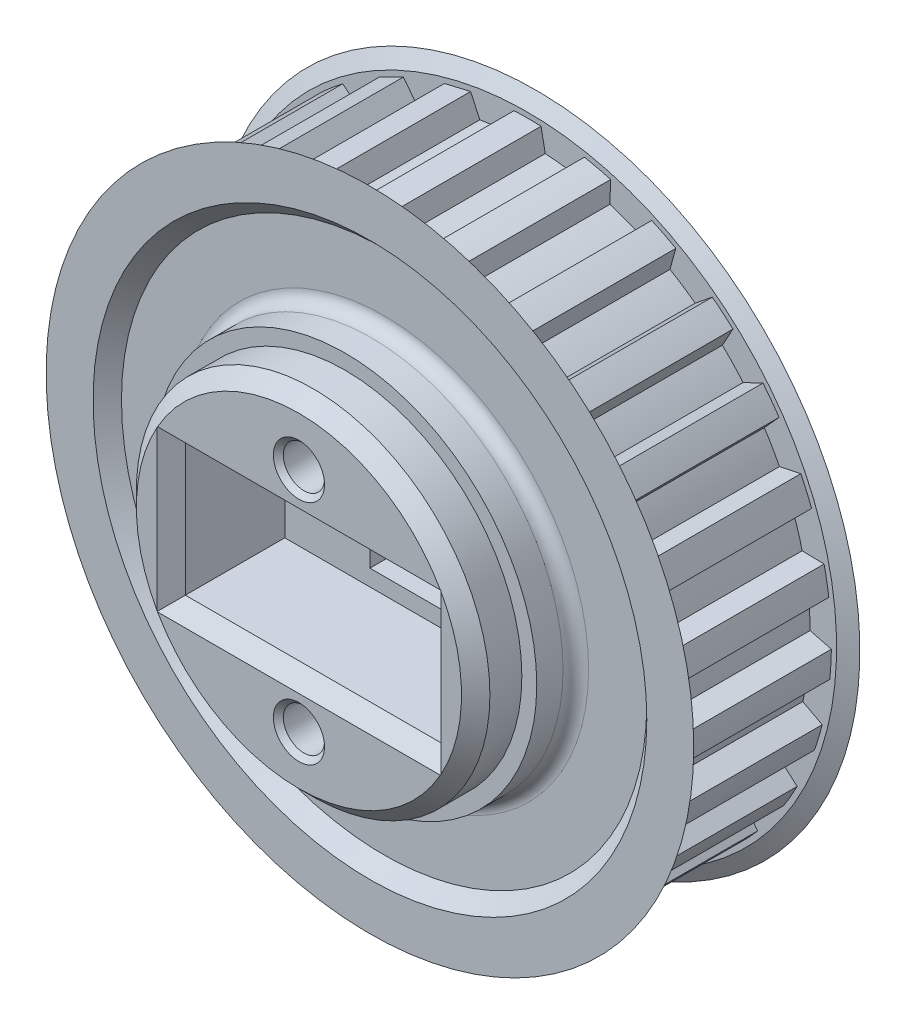
from build123d import *

# Parameters (mm, degrees)
CROQUIS1_R                 = 1.5
SALIENTE_EXTRUIR1_DEPTH    = 10.5
CROQUIS2_R                 = 23.5
CROQUIS2_R_2               = 1.5
SALIENTE_EXTRUIR2_DEPTH    = 0.6
SALIENTE_EXTRUIR4_START    = 5.25
CROQUIS4_R                 = 12.45
CROQUIS4_R_2               = 1.5
SALIENTE_EXTRUIR4_DEPTH    = 5.25
SALIENTE_EXTRUIR6_START    = 0.6
CROQUIS6_R                 = 23.5
CROQUIS6_R_2               = 1.5
SALIENTE_EXTRUIR6_DEPTH    = 0.6
SKETCH6_R                  = 18.5
SKETCH6_R_2                = 12.45
CUT_EXTRUDE3_DEPTH         = 1
SALIENTE_EXTRUIR5_START    = 2.65
CROQUIS5_R                 = 13.5
CROQUIS5_R_2               = 1.5
SALIENTE_EXTRUIR5_DEPTH    = 2.65
CHAFL_N2_SIZE              = 1.732050808
CHAFL_N2_SIZE_2            = 1
CROQUIS3_R                 = 12.45
CROQUIS3_R_2               = 1.5
SALIENTE_EXTRUIR7_DEPTH    = 5
CUT_EXTRUDE4_START         = -1
SKETCH7_R                  = 18.5
SKETCH7_R_2                = 12.45
CUT_EXTRUDE4_DEPTH         = 1
CHAFL_N4_SIZE              = 1
CROQUIS7_R                 = 13.5
CROQUIS7_R_2               = 1.5
SALIENTE_EXTRUIR8_DEPTH    = 2.75
CORTAR_EXTRUIR1_DEPTH      = 37.049200957
CORTAR_EXTRUIR1_DEPTH_BACK = 37.049200957
CROQUIS8_R                 = 1.45
CROQUIS8_W                 = 6
CROQUIS8_H                 = 7
CROQUIS10_W                = 18
CROQUIS10_H                = 9.3
CORTAR_EXTRUIR3_DEPTH      = 8
CHAFL_N5_SIZE              = 1
SKETCH1_R                  = 12.45
SKETCH1_R_2                = 1.45
BOSS_EXTRUDE1_DEPTH        = 5
SKETCH2_R                  = 1.45
CUT_EXTRUDE1_DEPTH         = 39.680193764
SKETCH4_W                  = 6
SKETCH4_H                  = 7
CUT_EXTRUDE2_DEPTH         = 30
CHAMFER3_SIZE              = 1
CHAMFER2_SIZE              = 0.75
CHAMFER4_SIZE              = 1
CHAMFER5_SIZE              = 0.35
FILLET1_R                  = 0.9


# Some blends are built 0.0001 mm under size
with BuildPart() as part:
    # Croquis1 → Saliente-Extruir1 (new body)
    with BuildSketch(Plane.XY):
        with BuildLine():
            Line((-0.95, 21.378903152), (-1.25, 19.860702404))
            ThreePointArc((-1.25, 19.860702404), (-2.310248991, 19.765443319), (-3.36388709, 19.613624439))
            Line((-3.36388709, 19.613624439), (-4.005921739, 21.021717128))
            Line((-4.005921739, 21.021717128), (-5.854706993, 20.583546974))
            Line((-5.854706993, 20.583546974), (-5.796499267, 19.037084762))
            ThreePointArc((-5.796499267, 19.037084762), (-6.806200852, 18.699883154), (-7.796426157, 18.309170904))
            Line((-7.796426157, 18.309170904), (-8.7458832, 19.531244892))
            Line((-8.7458832, 19.531244892), (-10.443785217, 18.67852645))
            Line((-10.443785217, 18.67852645), (-10.030507758, 17.187172953))
            ThreePointArc((-10.030507758, 17.187172953), (-10.935228664, 16.626207447), (-11.808657871, 16.017665226))
            Line((-11.808657871, 16.017665226), (-13.014351834, 16.987838189))
            ThreePointArc((-13.014351834, 16.987838189), (-13.755654847, 16.393351083), (-14.469836276, 15.766541731))
            Line((-14.469836276, 15.766541731), (-13.723768979, 14.410696201))
            ThreePointArc((-13.723768979, 14.410696201), (-14.474735467, 13.656208594), (-15.184281783, 12.862643069))
            Line((-15.184281783, 12.862643069), (-16.581213392, 13.528612732))
            ThreePointArc((-16.581213392, 13.528612732), (-17.165436325, 12.779193862), (-17.715814716, 12.004578666))
            Line((-17.715814716, 12.004578666), (-16.677178263, 10.857335087))
            ThreePointArc((-16.677178263, 10.857335087), (-17.233905535, 9.95), (-17.741317134, 9.014192495))
            Line((-17.741317134, 9.014192495), (-19.254177444, 9.34005626))
            ThreePointArc((-19.254177444, 9.34005626), (-19.649824687, 8.476106993), (-20.006729, 7.595445657))
            Line((-20.006729, 7.595445657), (-18.731516549, 6.718652228))
            ThreePointArc((-18.731516549, 6.718652228), (-19.063991295, 5.707384331), (-19.341913486, 4.679784471))
            Line((-19.341913486, 4.679784471), (-20.889143807, 4.647974938))
            ThreePointArc((-20.889143807, 4.647974938), (-21.074885914, 3.716071002), (-21.219075344, 2.776840208))
            Line((-21.219075344, 2.776840208), (-19.77603393, 2.217765088))
            ThreePointArc((-19.77603393, 2.217765088), (-19.86633235, 1.157082095), (-19.899782276, 0.093088054))
            Line((-19.899782276, 0.093088054), (-21.397971019, -0.294679916))
            ThreePointArc((-21.397971019, -0.294679916), (-21.363794587, -1.244299339), (-21.287495844, -2.191465416))
            Line((-21.287495844, -2.191465416), (-19.754420203, -2.402682341))
            ThreePointArc((-19.754420203, -2.402682341), (-19.597674285, -3.455598736), (-19.384848652, -4.498626763))
            Line((-19.384848652, -4.498626763), (-20.753228076, -5.221448499))
            ThreePointArc((-20.753228076, -5.221448499), (-20.500975564, -6.13758918), (-20.208301934, -7.041628573))
            Line((-20.208301934, -7.041628573), (-18.66784057, -6.893600544))
            ThreePointArc((-18.66784057, -6.893600544), (-18.272500527, -7.881987344), (-17.824872819, -8.847819448))
            Line((-17.824872819, -8.847819448), (-18.989673235, -9.866727443))
            ThreePointArc((-18.989673235, -9.866727443), (-18.532943641, -10.7), (-18.039673235, -11.51217571))
            Line((-18.039673235, -11.51217571), (-16.574872819, -11.012882957))
            ThreePointArc((-16.574872819, -11.012882957), (-15.962251536, -11.883455975), (-15.303953479, -12.720023895))
            Line((-15.303953479, -12.720023895), (-16.202380195, -13.980088556))
            ThreePointArc((-16.202380195, -13.980088556), (-15.56579593, -14.68557105), (-14.898521083, -15.362098475))
            Line((-14.898521083, -15.362098475), (-13.588349385, -14.538457999))
            ThreePointArc((-13.588349385, -14.538457999), (-12.791473433, -15.244284418), (-11.957994046, -15.906488562))
            Line((-11.957994046, -15.906488562), (-12.541612644, -17.339779476))
            ThreePointArc((-12.541612644, -17.339779476), (-11.759492131, -17.879439164), (-10.954185803, -18.383846534))
            Line((-10.954185803, -18.383846534), (-9.869274518, -17.280261008))
            ThreePointArc((-9.869274518, -17.280261008), (-8.931103686, -17.783289542), (-7.967376059, -18.235430314))
            Line((-7.967376059, -18.235430314), (-8.20472351, -19.764678397))
            ThreePointArc((-8.20472351, -19.764678397), (-7.319231067, -20.109422085), (-6.419307531, -20.414516669))
            Line((-6.419307531, -20.414516669), (-5.618144507, -19.090480672))
            ThreePointArc((-5.618144507, -19.090480672), (-4.589255828, -19.363592925), (-3.547234766, -19.581295297))
            Line((-3.547234766, -19.581295297), (-3.425515608, -21.124058389))
            ThreePointArc((-3.425515608, -21.124058389), (-2.484388362, -21.255300856), (-1.538362728, -21.344634926))
            Line((-1.538362728, -21.344634926), (-1.064138872, -19.871527583))
            ThreePointArc((-1.064138872, -19.871527583), (0, -19.9), (1.064138872, -19.871527583))
            Line((1.064138872, -19.871527583), (1.538362728, -21.344634926))
            ThreePointArc((1.538362728, -21.344634926), (2.484388362, -21.255300856), (3.425515608, -21.124058389))
            Line((3.425515608, -21.124058389), (3.547234766, -19.581295297))
            ThreePointArc((3.547234766, -19.581295297), (4.589255828, -19.363592925), (5.618144507, -19.090480672))
            Line((5.618144507, -19.090480672), (6.419307531, -20.414516669))
            ThreePointArc((6.419307531, -20.414516669), (7.319231067, -20.109422085), (8.20472351, -19.764678397))
            Line((8.20472351, -19.764678397), (7.967376059, -18.235430314))
            ThreePointArc((7.967376059, -18.235430314), (8.931103686, -17.783289542), (9.869274518, -17.280261008))
            Line((9.869274518, -17.280261008), (10.954185803, -18.383846534))
            ThreePointArc((10.954185803, -18.383846534), (11.759492131, -17.879439164), (12.541612644, -17.339779476))
            Line((12.541612644, -17.339779476), (11.957994046, -15.906488562))
            ThreePointArc((11.957994046, -15.906488562), (12.791473433, -15.244284418), (13.588349385, -14.538457999))
            Line((13.588349385, -14.538457999), (14.898521083, -15.362098475))
            ThreePointArc((14.898521083, -15.362098475), (15.56579593, -14.68557105), (16.202380195, -13.980088556))
            Line((16.202380195, -13.980088556), (15.303953479, -12.720023895))
            ThreePointArc((15.303953479, -12.720023895), (15.962251536, -11.883455975), (16.574872819, -11.012882957))
            Line((16.574872819, -11.012882957), (18.039673235, -11.51217571))
            ThreePointArc((18.039673235, -11.51217571), (18.532943641, -10.7), (18.989673235, -9.866727443))
            Line((18.989673235, -9.866727443), (17.824872819, -8.847819448))
            ThreePointArc((17.824872819, -8.847819448), (18.272500527, -7.881987344), (18.66784057, -6.893600544))
            Line((18.66784057, -6.893600544), (20.208301934, -7.041628573))
            ThreePointArc((20.208301934, -7.041628573), (20.500975564, -6.13758918), (20.753228076, -5.221448499))
            Line((20.753228076, -5.221448499), (19.384848652, -4.498626763))
            ThreePointArc((19.384848652, -4.498626763), (19.597674285, -3.455598736), (19.754420203, -2.402682341))
            Line((19.754420203, -2.402682341), (21.287495844, -2.191465416))
            ThreePointArc((21.287495844, -2.191465416), (21.363794587, -1.244299339), (21.397971019, -0.294679916))
            Line((21.397971019, -0.294679916), (19.899782276, 0.093088054))
            ThreePointArc((19.899782276, 0.093088054), (19.86633235, 1.157082095), (19.77603393, 2.217765088))
            Line((19.77603393, 2.217765088), (21.219075344, 2.776840208))
            ThreePointArc((21.219075344, 2.776840208), (21.074885914, 3.716071002), (20.889143807, 4.647974938))
            Line((20.889143807, 4.647974938), (19.341913486, 4.679784471))
            ThreePointArc((19.341913486, 4.679784471), (19.063991295, 5.707384331), (18.731516549, 6.718652228))
            Line((18.731516549, 6.718652228), (20.006729, 7.595445657))
            ThreePointArc((20.006729, 7.595445657), (19.649824687, 8.476106993), (19.254177444, 9.34005626))
            Line((19.254177444, 9.34005626), (17.741317134, 9.014192495))
            ThreePointArc((17.741317134, 9.014192495), (17.233905535, 9.95), (16.677178263, 10.857335087))
            Line((16.677178263, 10.857335087), (17.715814716, 12.004578666))
            ThreePointArc((17.715814716, 12.004578666), (17.165436325, 12.779193862), (16.581213392, 13.528612732))
            Line((16.581213392, 13.528612732), (15.184281783, 12.862643069))
            ThreePointArc((15.184281783, 12.862643069), (14.474735467, 13.656208594), (13.723768979, 14.410696201))
            Line((13.723768979, 14.410696201), (14.469836276, 15.766541731))
            ThreePointArc((14.469836276, 15.766541731), (13.755654847, 16.393351083), (13.014351834, 16.987838189))
            Line((13.014351834, 16.987838189), (11.808657871, 16.017665226))
            ThreePointArc((11.808657871, 16.017665226), (10.935228664, 16.626207447), (10.030507758, 17.187172953))
            Line((10.030507758, 17.187172953), (10.443785217, 18.67852645))
            ThreePointArc((10.443785217, 18.67852645), (9.604302456, 19.123738503), (8.7458832, 19.531244892))
            Line((8.7458832, 19.531244892), (7.796426157, 18.309170904))
            ThreePointArc((7.796426157, 18.309170904), (6.806200852, 18.699883154), (5.796499267, 19.037084762))
            Line((5.796499267, 19.037084762), (5.854706993, 20.583546974))
            ThreePointArc((5.854706993, 20.583546974), (4.935179634, 20.82316023), (4.005921739, 21.021717128))
            Line((4.005921739, 21.021717128), (3.36388709, 19.613624439))
            ThreePointArc((3.36388709, 19.613624439), (2.310248991, 19.765443319), (1.25, 19.860702404))
            Line((1.25, 19.860702404), (0.95, 21.378903152))
            ThreePointArc((0.95, 21.378903152), (0, 21.4), (-0.95, 21.378903152))
        make_face()
        with Locations(Location((0, 0, 0), (0, 0, 180))):
            Circle(CROQUIS1_R, mode=Mode.SUBTRACT)
    extrude(amount=SALIENTE_EXTRUIR1_DEPTH)

    # Croquis2 → Saliente-Extruir2 (add)
    with BuildSketch(Plane.XY.offset(10.5)):
        Circle(CROQUIS2_R)
        with Locations(Location((0, 0, 0), (0, 0, 180))):
            Circle(CROQUIS2_R_2, mode=Mode.SUBTRACT)
    extrude(amount=SALIENTE_EXTRUIR2_DEPTH)

    # Croquis4 → Saliente-Extruir4 (add)
    with BuildSketch(Plane(origin=(0, 0, 0), x_dir=(-1, 0, 0), z_dir=(0, 0, -1)).offset(SALIENTE_EXTRUIR4_START)):
        with Locations(Location((0, 0, 0), (0, 0, 180))):
            Circle(CROQUIS4_R)
        Circle(CROQUIS4_R_2, mode=Mode.SUBTRACT)
    extrude(amount=-SALIENTE_EXTRUIR4_DEPTH)

    # Croquis6 → Saliente-Extruir6 (add)
    with BuildSketch(Plane(origin=(0, 0, 0), x_dir=(-1, 0, 0), z_dir=(0, 0, -1)).offset(SALIENTE_EXTRUIR6_START)):
        with Locations(Location((0, 0, 0), (0, 0, 180))):
            Circle(CROQUIS6_R)
        Circle(CROQUIS6_R_2, mode=Mode.SUBTRACT)
    extrude(amount=-SALIENTE_EXTRUIR6_DEPTH)

    # Sketch6 → Cut-Extrude3 (cut)
    with BuildSketch(Plane(origin=(0, 0, -0.6), x_dir=(-1, 0, 0), z_dir=(0, 0, -1))):
        Circle(SKETCH6_R)
        with Locations(Location((0, 0, 0), (0, 0, 180))):
            Circle(SKETCH6_R_2, mode=Mode.SUBTRACT)
    extrude(amount=-CUT_EXTRUDE3_DEPTH, mode=Mode.SUBTRACT)

    # Croquis5 → Saliente-Extruir5 (add)
    with BuildSketch(Plane(origin=(0, 0, 0.4), x_dir=(-1, 0, 0), z_dir=(0, 0, -1)).offset(SALIENTE_EXTRUIR5_START)):
        Circle(CROQUIS5_R)
        Circle(CROQUIS5_R_2, mode=Mode.SUBTRACT)
    extrude(amount=-SALIENTE_EXTRUIR5_DEPTH)

    # Chaflán2
    # the kernel refuses this chamfer: 1.732050808, 1 mm, written as the material it takes off along each edge
    with BuildSketch(Plane(origin=(0, 0, 0), x_dir=(1, 0, 0), z_dir=(0, 1, 0))) as chafl_n2_piece_1:
        Polygon((23.5 - CHAFL_N2_SIZE, 0), (23.5, CHAFL_N2_SIZE_2), (23.5, 0), align=None)
    revolve(axis=Axis((0, 0, 0), (0, 0, -1)), mode=Mode.SUBTRACT)
    with BuildSketch(Plane(origin=(0, 0, 10.5), x_dir=(1, 0, 0), z_dir=(0, -1, 0))) as chafl_n2_piece_2:
        Polygon((23.5 - CHAFL_N2_SIZE, 0), (23.5, CHAFL_N2_SIZE_2), (23.5, 0), align=None)
    revolve(axis=Axis((0, 0, 10.5), (0, 0, 1)), mode=Mode.SUBTRACT)

    # Croquis3 → Saliente-Extruir7 (add)
    with BuildSketch(Plane.XY.offset(11.1)):
        Circle(CROQUIS3_R)
        with Locations(Location((0, 0, 0), (0, 0, 180))):
            Circle(CROQUIS3_R_2, mode=Mode.SUBTRACT)
    extrude(amount=SALIENTE_EXTRUIR7_DEPTH)

    # Sketch7 → Cut-Extrude4 (cut)
    with BuildSketch(Plane.XY.offset(11.1).offset(CUT_EXTRUDE4_START)):
        with Locations(Location((0, 0, 0), (0, 0, 180))):
            Circle(SKETCH7_R)
        Circle(SKETCH7_R_2, mode=Mode.SUBTRACT)
    extrude(amount=CUT_EXTRUDE4_DEPTH, mode=Mode.SUBTRACT)

    # Chaflán4
    chafl_n4_edges = [part.edges().sort_by_distance(p)[0] for p in [
        (-12.45, 0, 16.1),
    ]]
    chamfer(chafl_n4_edges, length=CHAFL_N4_SIZE)

    # Croquis7 → Saliente-Extruir8 (add)
    with BuildSketch(Plane.XY.offset(10.1)):
        with Locations(Location((0, 0, 0), (0, 0, 180))):
            Circle(CROQUIS7_R)
        with Locations(Location((0, 0, 0), (0, 0, 180))):
            Circle(CROQUIS7_R_2, mode=Mode.SUBTRACT)
    extrude(amount=SALIENTE_EXTRUIR8_DEPTH)

    # Croquis8 → Cortar-Extruir1 (cut, two sides: drawn at the far end of the back side and taken through both)
    with BuildSketch(Plane.XY.offset(-CORTAR_EXTRUIR1_DEPTH_BACK)):
        with Locations((0, 8)):
            Circle(CROQUIS8_R)
        with Locations((0, -8)):
            Circle(CROQUIS8_R)
        Rectangle(CROQUIS8_W, CROQUIS8_H)
    extrude(amount=CORTAR_EXTRUIR1_DEPTH + CORTAR_EXTRUIR1_DEPTH_BACK, mode=Mode.SUBTRACT)

    # Croquis10 → Cortar-Extruir3 (cut)
    with BuildSketch(Plane.XY.offset(16.1)):
        Rectangle(CROQUIS10_W, CROQUIS10_H)
    extrude(amount=-CORTAR_EXTRUIR3_DEPTH, mode=Mode.SUBTRACT)

    # Chaflán5
    # the kernel refuses this chamfer: 1 mm, written as the material it takes off along each edge
    with BuildSketch(Plane(origin=(3, 3.5, -5.25), x_dir=(0.9996219169112968, 0, -0.027495876610586487), z_dir=(0, -1, 0)), Plane(origin=(-3, -3.5, -5.25), x_dir=(-0.9996219169112968, 0, -0.027495876610586487), z_dir=(0, 1, 0))) as chafl_n5_piece_1:
        Polygon((CHAFL_N5_SIZE * 0.999621916911, CHAFL_N5_SIZE * 0.0274958766106), (-CHAFL_N5_SIZE * 0.0274958766106, CHAFL_N5_SIZE * 0.999621916911), (0, 0), align=None)
    extrude(amount=7, mode=Mode.SUBTRACT)
    with BuildSketch(Plane(origin=(3, -3.5, -5.25), x_dir=(0, -0.9996219169112968, -0.027495876610586473), z_dir=(-1, 0, 0)), Plane(origin=(-3, 3.5, -5.25), x_dir=(0, 0.9996219169112968, -0.027495876610586487), z_dir=(1, 0, 0))) as chafl_n5_piece_2:
        Polygon((CHAFL_N5_SIZE * 0.999621916911, CHAFL_N5_SIZE * 0.0274958766106), (-CHAFL_N5_SIZE * 0.0274958766106, CHAFL_N5_SIZE * 0.999621916911), (0, 0), align=None)
    extrude(amount=6, mode=Mode.SUBTRACT)
    with BuildSketch(Plane(origin=(-9, 4.65, 16.1), x_dir=(-0.9996219169112968, 0, 0.027495876610585647), z_dir=(0, -1, 0)), Plane(origin=(9, -4.65, 16.1), x_dir=(0.9996219169112968, 0, 0.027495876610585647), z_dir=(0, 1, 0))) as chafl_n5_piece_3:
        Polygon((CHAFL_N5_SIZE * 0.999621916911, CHAFL_N5_SIZE * 0.0274958766106), (-CHAFL_N5_SIZE * 0.0274958766106, CHAFL_N5_SIZE * 0.999621916911), (0, 0), align=None)
    extrude(amount=9.3, mode=Mode.SUBTRACT)
    with BuildSketch(Plane(origin=(-9, -4.65, 16.1), x_dir=(0, -0.9996219169112968, 0.027495876610585623), z_dir=(1, 0, 0)), Plane(origin=(9, 4.65, 16.1), x_dir=(0, 0.9996219169112968, 0.027495876610585623), z_dir=(-1, 0, 0))) as chafl_n5_piece_4:
        Polygon((CHAFL_N5_SIZE * 0.999621916911, CHAFL_N5_SIZE * 0.0274958766106), (-CHAFL_N5_SIZE * 0.0274958766106, CHAFL_N5_SIZE * 0.999621916911), (0, 0), align=None)
    extrude(amount=18, mode=Mode.SUBTRACT)
    with BuildSketch(Plane(origin=(-3, 3.5, -5.25), x_dir=(0, 0.9996219169112968, -0.027495876610586487), z_dir=(1, 0, 0))) as chafl_n5_piece_5a_section:
        Polygon((CHAFL_N5_SIZE * 0.999621916911, CHAFL_N5_SIZE * 0.0274958766106), (-CHAFL_N5_SIZE * 0.0274958766106, CHAFL_N5_SIZE * 0.999621916911), (0, 0), align=None)
    chafl_n5_piece_5a = extrude(amount=8.571682988, mode=Mode.PRIVATE)
    chafl_n5_piece_5a = split(chafl_n5_piece_5a, bisect_by=Plane(origin=(3, 3.829793627, -4.920206373), z_dir=(1, 0, 0)), keep=Keep.TOP, mode=Mode.PRIVATE)
    with BuildSketch(Plane(origin=(3, 6.071682988, -5.25), x_dir=(0.9996219169112968, 0, -0.027495876610586487), z_dir=(0, -1, 0))) as chafl_n5_piece_5b_section:
        Polygon((CHAFL_N5_SIZE * 0.999621916911, CHAFL_N5_SIZE * 0.0274958766106), (-CHAFL_N5_SIZE * 0.0274958766106, CHAFL_N5_SIZE * 0.999621916911), (0, 0), align=None)
    chafl_n5_piece_5b = extrude(amount=9.571682988, mode=Mode.PRIVATE)
    chafl_n5_piece_5b = split(chafl_n5_piece_5b, bisect_by=Plane(origin=(3.329793627, 3.5, -4.920206373), z_dir=(0, 1, 0)), keep=Keep.TOP, mode=Mode.PRIVATE)
    chafl_n5_piece_5 = chafl_n5_piece_5a & chafl_n5_piece_5b
    add(chafl_n5_piece_5, mode=Mode.SUBTRACT)
    with BuildSketch(Plane(origin=(3, 3.5, -5.25), x_dir=(0.9996219169112968, 0, -0.027495876610586487), z_dir=(0, -1, 0))) as chafl_n5_piece_6a_section:
        Polygon((CHAFL_N5_SIZE * 0.999621916911, CHAFL_N5_SIZE * 0.0274958766106), (-CHAFL_N5_SIZE * 0.0274958766106, CHAFL_N5_SIZE * 0.999621916911), (0, 0), align=None)
    chafl_n5_piece_6a = extrude(amount=9.571682988, mode=Mode.PRIVATE)
    chafl_n5_piece_6a = split(chafl_n5_piece_6a, bisect_by=Plane(origin=(3.329793627, -3.5, -4.920206373), z_dir=(0, -1, 0)), keep=Keep.TOP, mode=Mode.PRIVATE)
    with BuildSketch(Plane(origin=(5.571682988, -3.5, -5.25), x_dir=(0, -0.9996219169112968, -0.027495876610586473), z_dir=(-1, 0, 0))) as chafl_n5_piece_6b_section:
        Polygon((CHAFL_N5_SIZE * 0.999621916911, CHAFL_N5_SIZE * 0.0274958766106), (-CHAFL_N5_SIZE * 0.0274958766106, CHAFL_N5_SIZE * 0.999621916911), (0, 0), align=None)
    chafl_n5_piece_6b = extrude(amount=8.571682988, mode=Mode.PRIVATE)
    chafl_n5_piece_6b = split(chafl_n5_piece_6b, bisect_by=Plane(origin=(3, -3.829793627, -4.920206373), z_dir=(1, 0, 0)), keep=Keep.TOP, mode=Mode.PRIVATE)
    chafl_n5_piece_6 = chafl_n5_piece_6a & chafl_n5_piece_6b
    add(chafl_n5_piece_6, mode=Mode.SUBTRACT)
    with BuildSketch(Plane(origin=(3, -3.5, -5.25), x_dir=(0, -0.9996219169112968, -0.027495876610586473), z_dir=(-1, 0, 0))) as chafl_n5_piece_7a_section:
        Polygon((CHAFL_N5_SIZE * 0.999621916911, CHAFL_N5_SIZE * 0.0274958766106), (-CHAFL_N5_SIZE * 0.0274958766106, CHAFL_N5_SIZE * 0.999621916911), (0, 0), align=None)
    chafl_n5_piece_7a = extrude(amount=8.571682988, mode=Mode.PRIVATE)
    chafl_n5_piece_7a = split(chafl_n5_piece_7a, bisect_by=Plane(origin=(-3, -3.829793627, -4.920206373), z_dir=(-1, 0, 0)), keep=Keep.TOP, mode=Mode.PRIVATE)
    with BuildSketch(Plane(origin=(-3, -6.071682988, -5.25), x_dir=(-0.9996219169112968, 0, -0.027495876610586487), z_dir=(0, 1, 0))) as chafl_n5_piece_7b_section:
        Polygon((CHAFL_N5_SIZE * 0.999621916911, CHAFL_N5_SIZE * 0.0274958766106), (-CHAFL_N5_SIZE * 0.0274958766106, CHAFL_N5_SIZE * 0.999621916911), (0, 0), align=None)
    chafl_n5_piece_7b = extrude(amount=9.571682988, mode=Mode.PRIVATE)
    chafl_n5_piece_7b = split(chafl_n5_piece_7b, bisect_by=Plane(origin=(-3.329793627, -3.5, -4.920206373), z_dir=(0, -1, 0)), keep=Keep.TOP, mode=Mode.PRIVATE)
    chafl_n5_piece_7 = chafl_n5_piece_7a & chafl_n5_piece_7b
    add(chafl_n5_piece_7, mode=Mode.SUBTRACT)
    with BuildSketch(Plane(origin=(-5.571682988, 3.5, -5.25), x_dir=(0, 0.9996219169112968, -0.027495876610586487), z_dir=(1, 0, 0))) as chafl_n5_piece_8a_section:
        Polygon((CHAFL_N5_SIZE * 0.999621916911, CHAFL_N5_SIZE * 0.0274958766106), (-CHAFL_N5_SIZE * 0.0274958766106, CHAFL_N5_SIZE * 0.999621916911), (0, 0), align=None)
    chafl_n5_piece_8a = extrude(amount=8.571682988, mode=Mode.PRIVATE)
    chafl_n5_piece_8a = split(chafl_n5_piece_8a, bisect_by=Plane(origin=(-3, 3.829793627, -4.920206373), z_dir=(-1, 0, 0)), keep=Keep.TOP, mode=Mode.PRIVATE)
    with BuildSketch(Plane(origin=(-3, -3.5, -5.25), x_dir=(-0.9996219169112968, 0, -0.027495876610586487), z_dir=(0, 1, 0))) as chafl_n5_piece_8b_section:
        Polygon((CHAFL_N5_SIZE * 0.999621916911, CHAFL_N5_SIZE * 0.0274958766106), (-CHAFL_N5_SIZE * 0.0274958766106, CHAFL_N5_SIZE * 0.999621916911), (0, 0), align=None)
    chafl_n5_piece_8b = extrude(amount=9.571682988, mode=Mode.PRIVATE)
    chafl_n5_piece_8b = split(chafl_n5_piece_8b, bisect_by=Plane(origin=(-3.329793627, 3.5, -4.920206373), z_dir=(0, 1, 0)), keep=Keep.TOP, mode=Mode.PRIVATE)
    chafl_n5_piece_8 = chafl_n5_piece_8a & chafl_n5_piece_8b
    add(chafl_n5_piece_8, mode=Mode.SUBTRACT)
    with BuildSketch(Plane(origin=(9, 4.65, 16.1), x_dir=(0, 0.9996219169112968, 0.027495876610585623), z_dir=(-1, 0, 0))) as chafl_n5_piece_9a_section:
        Polygon((CHAFL_N5_SIZE * 0.999621916911, CHAFL_N5_SIZE * 0.0274958766106), (-CHAFL_N5_SIZE * 0.0274958766106, CHAFL_N5_SIZE * 0.999621916911), (0, 0), align=None)
    chafl_n5_piece_9a = extrude(amount=20.571682988, mode=Mode.PRIVATE)
    chafl_n5_piece_9a = split(chafl_n5_piece_9a, bisect_by=Plane(origin=(-9, 4.979793627, 15.770206373), z_dir=(-1, 0, 0)), keep=Keep.TOP, mode=Mode.PRIVATE)
    with BuildSketch(Plane(origin=(-9, 7.221682988, 16.1), x_dir=(-0.9996219169112968, 0, 0.027495876610585647), z_dir=(0, -1, 0))) as chafl_n5_piece_9b_section:
        Polygon((CHAFL_N5_SIZE * 0.999621916911, CHAFL_N5_SIZE * 0.0274958766106), (-CHAFL_N5_SIZE * 0.0274958766106, CHAFL_N5_SIZE * 0.999621916911), (0, 0), align=None)
    chafl_n5_piece_9b = extrude(amount=11.871682988, mode=Mode.PRIVATE)
    chafl_n5_piece_9b = split(chafl_n5_piece_9b, bisect_by=Plane(origin=(-9.329793627, 4.65, 15.770206373), z_dir=(0, 1, 0)), keep=Keep.TOP, mode=Mode.PRIVATE)
    chafl_n5_piece_9 = chafl_n5_piece_9a & chafl_n5_piece_9b
    add(chafl_n5_piece_9, mode=Mode.SUBTRACT)
    with BuildSketch(Plane(origin=(-9, 4.65, 16.1), x_dir=(-0.9996219169112968, 0, 0.027495876610585647), z_dir=(0, -1, 0))) as chafl_n5_piece_10a_section:
        Polygon((CHAFL_N5_SIZE * 0.999621916911, CHAFL_N5_SIZE * 0.0274958766106), (-CHAFL_N5_SIZE * 0.0274958766106, CHAFL_N5_SIZE * 0.999621916911), (0, 0), align=None)
    chafl_n5_piece_10a = extrude(amount=11.871682988, mode=Mode.PRIVATE)
    chafl_n5_piece_10a = split(chafl_n5_piece_10a, bisect_by=Plane(origin=(-9.329793627, -4.65, 15.770206373), z_dir=(0, -1, 0)), keep=Keep.TOP, mode=Mode.PRIVATE)
    with BuildSketch(Plane(origin=(-11.571682988, -4.65, 16.1), x_dir=(0, -0.9996219169112968, 0.027495876610585623), z_dir=(1, 0, 0))) as chafl_n5_piece_10b_section:
        Polygon((CHAFL_N5_SIZE * 0.999621916911, CHAFL_N5_SIZE * 0.0274958766106), (-CHAFL_N5_SIZE * 0.0274958766106, CHAFL_N5_SIZE * 0.999621916911), (0, 0), align=None)
    chafl_n5_piece_10b = extrude(amount=20.571682988, mode=Mode.PRIVATE)
    chafl_n5_piece_10b = split(chafl_n5_piece_10b, bisect_by=Plane(origin=(-9, -4.979793627, 15.770206373), z_dir=(-1, 0, 0)), keep=Keep.TOP, mode=Mode.PRIVATE)
    chafl_n5_piece_10 = chafl_n5_piece_10a & chafl_n5_piece_10b
    add(chafl_n5_piece_10, mode=Mode.SUBTRACT)
    with BuildSketch(Plane(origin=(-9, -4.65, 16.1), x_dir=(0, -0.9996219169112968, 0.027495876610585623), z_dir=(1, 0, 0))) as chafl_n5_piece_11a_section:
        Polygon((CHAFL_N5_SIZE * 0.999621916911, CHAFL_N5_SIZE * 0.0274958766106), (-CHAFL_N5_SIZE * 0.0274958766106, CHAFL_N5_SIZE * 0.999621916911), (0, 0), align=None)
    chafl_n5_piece_11a = extrude(amount=20.571682988, mode=Mode.PRIVATE)
    chafl_n5_piece_11a = split(chafl_n5_piece_11a, bisect_by=Plane(origin=(9, -4.979793627, 15.770206373), z_dir=(1, 0, 0)), keep=Keep.TOP, mode=Mode.PRIVATE)
    with BuildSketch(Plane(origin=(9, -7.221682988, 16.1), x_dir=(0.9996219169112968, 0, 0.027495876610585647), z_dir=(0, 1, 0))) as chafl_n5_piece_11b_section:
        Polygon((CHAFL_N5_SIZE * 0.999621916911, CHAFL_N5_SIZE * 0.0274958766106), (-CHAFL_N5_SIZE * 0.0274958766106, CHAFL_N5_SIZE * 0.999621916911), (0, 0), align=None)
    chafl_n5_piece_11b = extrude(amount=11.871682988, mode=Mode.PRIVATE)
    chafl_n5_piece_11b = split(chafl_n5_piece_11b, bisect_by=Plane(origin=(9.329793627, -4.65, 15.770206373), z_dir=(0, -1, 0)), keep=Keep.TOP, mode=Mode.PRIVATE)
    chafl_n5_piece_11 = chafl_n5_piece_11a & chafl_n5_piece_11b
    add(chafl_n5_piece_11, mode=Mode.SUBTRACT)
    with BuildSketch(Plane(origin=(11.571682988, 4.65, 16.1), x_dir=(0, 0.9996219169112968, 0.027495876610585623), z_dir=(-1, 0, 0))) as chafl_n5_piece_12a_section:
        Polygon((CHAFL_N5_SIZE * 0.999621916911, CHAFL_N5_SIZE * 0.0274958766106), (-CHAFL_N5_SIZE * 0.0274958766106, CHAFL_N5_SIZE * 0.999621916911), (0, 0), align=None)
    chafl_n5_piece_12a = extrude(amount=20.571682988, mode=Mode.PRIVATE)
    chafl_n5_piece_12a = split(chafl_n5_piece_12a, bisect_by=Plane(origin=(9, 4.979793627, 15.770206373), z_dir=(1, 0, 0)), keep=Keep.TOP, mode=Mode.PRIVATE)
    with BuildSketch(Plane(origin=(9, -4.65, 16.1), x_dir=(0.9996219169112968, 0, 0.027495876610585647), z_dir=(0, 1, 0))) as chafl_n5_piece_12b_section:
        Polygon((CHAFL_N5_SIZE * 0.999621916911, CHAFL_N5_SIZE * 0.0274958766106), (-CHAFL_N5_SIZE * 0.0274958766106, CHAFL_N5_SIZE * 0.999621916911), (0, 0), align=None)
    chafl_n5_piece_12b = extrude(amount=11.871682988, mode=Mode.PRIVATE)
    chafl_n5_piece_12b = split(chafl_n5_piece_12b, bisect_by=Plane(origin=(9.329793627, 4.65, 15.770206373), z_dir=(0, 1, 0)), keep=Keep.TOP, mode=Mode.PRIVATE)
    chafl_n5_piece_12 = chafl_n5_piece_12a & chafl_n5_piece_12b
    add(chafl_n5_piece_12, mode=Mode.SUBTRACT)

    # Sketch1 → Boss-Extrude1 (add)
    with BuildSketch(Plane(origin=(0, 0, -5.25), x_dir=(-1, 0, 0), z_dir=(0, 0, -1))):
        with Locations(Location((0, 0, 0), (0, 0, 180))):
            Circle(SKETCH1_R)
        with Locations(Location((0, 8, 0), (0, 0, 180))):
            Circle(SKETCH1_R_2, mode=Mode.SUBTRACT)
        with Locations(Location((0, -8, 0), (0, 0, 180))):
            Circle(SKETCH1_R_2, mode=Mode.SUBTRACT)
    extrude(amount=-BOSS_EXTRUDE1_DEPTH)

    # Sketch2 → Cut-Extrude1 (cut, through all)
    with BuildSketch(Plane(origin=(0, 0, -5.25), x_dir=(-1, 0, 0), z_dir=(0, 0, -1))):
        with Locations((-6.5, 0)):
            Circle(SKETCH2_R)
        with Locations((6.5, 0)):
            Circle(SKETCH2_R)
    extrude(amount=-CUT_EXTRUDE1_DEPTH, mode=Mode.SUBTRACT)

    # Sketch4 → Cut-Extrude2 (cut)
    with BuildSketch(Plane.XY.offset(16.1)):
        Rectangle(SKETCH4_W, SKETCH4_H)
    extrude(amount=-CUT_EXTRUDE2_DEPTH, mode=Mode.SUBTRACT)

    # Chamfer3
    chamfer3_edges = [part.edges().sort_by_distance(p)[0] for p in [
        (-3, 0, -5.25),
        (0, 3.5, -5.25),
        (3, 0, -5.25),
        (0, -3.5, -5.25),
    ]]
    chamfer(chamfer3_edges, length=CHAMFER3_SIZE - 0.0001)  # a hair under: the kernel refuses the full size

    # Chamfer2
    chamfer2_edges = [part.edges().sort_by_distance(p)[0] for p in [
        (-12.45, 0, -5.25),
    ]]
    chamfer(chamfer2_edges, length=CHAMFER2_SIZE)

    # Chamfer4
    chamfer4_edges = [part.edges().sort_by_distance(p)[0] for p in [
        (18.5, 0, -0.6),
        (18.5, 0, 11.1),
    ]]
    chamfer(chamfer4_edges, length=CHAMFER4_SIZE - 0.0001)  # a hair under: the kernel refuses the full size

    # Chamfer5
    chamfer5_edges = [part.edges().sort_by_distance(p)[0] for p in [
        (-1.45, -8, -5.25),
        (-1.45, -8, 16.1),
        (-1.45, 8, -5.25),
        (-1.45, 8, 16.1),
        (7.95, 0, 8.1),
        (7.95, 0, -5.25),
        (-5.05, 0, 8.1),
        (-5.05, 0, -5.25),
    ]]
    chamfer(chamfer5_edges, length=CHAMFER5_SIZE)

    # Fillet1
    fillet1_edges = [part.edges().sort_by_distance(p)[0] for p in [
        (13.5, 0, 0.4),
        (13.5, 0, 10.1),
    ]]
    fillet(fillet1_edges, radius=FILLET1_R)


solid = part.part
